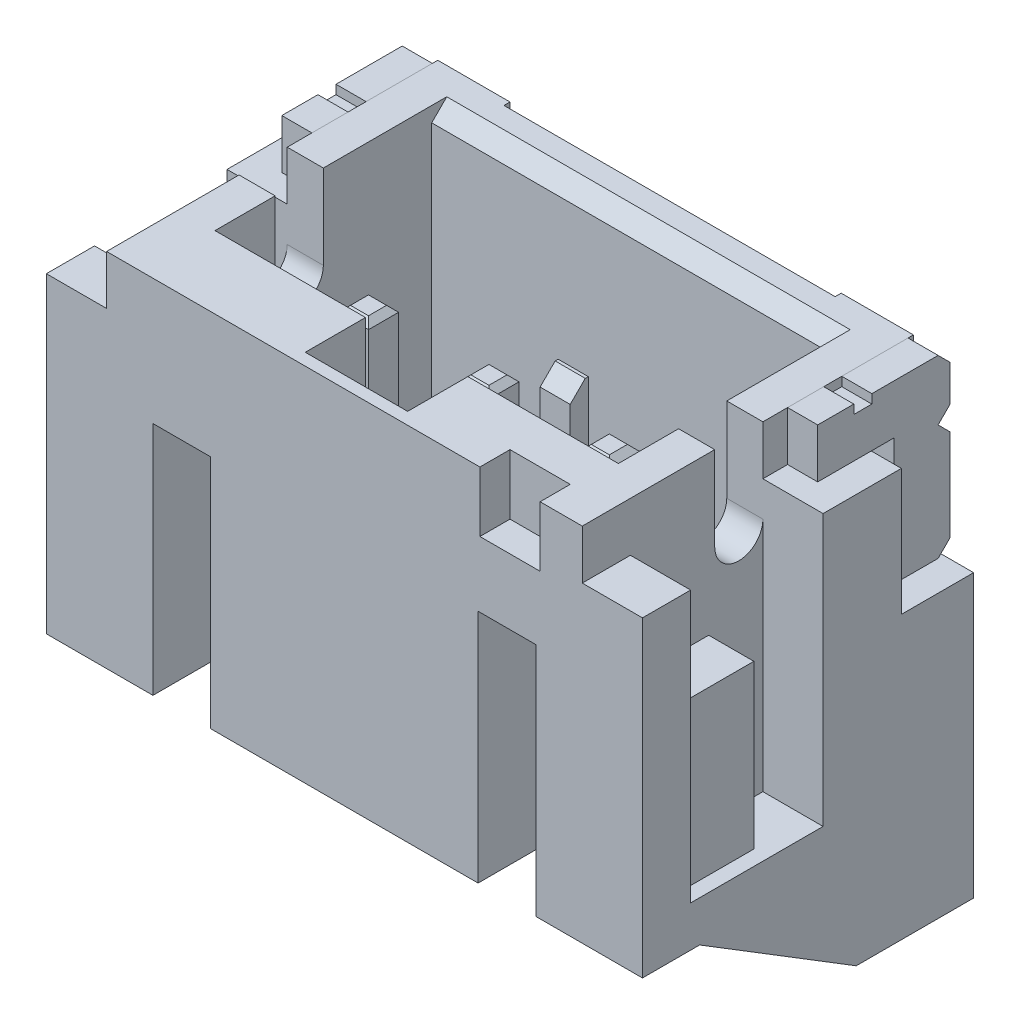
from build123d import *
from OCP.BRepFilletAPI import BRepFilletAPI_MakeChamfer

# Parameters (mm, degrees)
BODY1_W                               = 7.9
BODY1_H                               = 5.5
EXTRUDE_1_DEPTH                       = 6
SKETCH_2_W                            = 6.7
SKETCH_2_H                            = 3.6
CUT_EXTRUDE_1_DEPTH                   = 4.2
SKETCH_5_W                            = 0.7
SKETCH_5_H                            = 4.15
CUT_EXTRUDE_4_DEPTH                   = 0.4
SKETCH_8_W                            = 1.7
SKETCH_8_H                            = 4.2
CUT_EXTRUDE_6_DEPTH                   = 0.75
CUT_EXTRUDE_7_REACH                   = 13.343
SKETCH_10_W                           = 0.5
SKETCH_10_H                           = 1.6
EXTRUDE_2_DEPTH                       = 0.3
CHAMFER_2_SIZE                        = 0.25
PATTERN_LINEAR_3_COUNT                = 2
PATTERN_LINEAR_3_PITCH                = 2
CHAMFER_2_OF_PATTERN_LINEAR_3_SIZE    = 0.25
SKETCH_18_W                           = 5.5
SKETCH_18_H                           = 6
CUT_EXTRUDE_8_DEPTH                   = 0.1
EXTRUDE_6_DEPTH                       = 1
SKETCH_20_W                           = 1.3
SKETCH_20_H                           = 2.7
EXTRUDE_7_DEPTH                       = 0.75
EXTRUDE_8_DEPTH                       = 0.5
CHAMFER_9_SIZE                        = 0.25
SWEEP_START                           = 1.7
SWEEP_1_DEPTH                         = 0.5
CHAMFER_8_SIZE                        = 0.1
SKETCH_22_W                           = 1.6
SKETCH_22_H                           = 3.25
EXTRUDE_9_DEPTH                       = 0.2
CHAMFER_10_SIZE                       = 0.072794047
CHAMFER_10_SIZE_2                     = 0.2
CHAMFER_11_SIZE2                      = 0.2
CHAMFER_11_SIZE                       = 0.549495484
PATTERN_LINEAR_5_COUNT                = 3
PATTERN_LINEAR_5_PITCH                = 2
CHAMFER_8_OF_PATTERN_LINEAR_5_SIZE    = 0.1
CHAMFER_10_OF_PATTERN_LINEAR_5_SIZE   = 0.072794047
CHAMFER_10_OF_PATTERN_LINEAR_5_SIZE_2 = 0.2
CHAMFER_11_OF_PATTERN_LINEAR_5_SIZE   = 0.549495484
CHAMFER_11_OF_PATTERN_LINEAR_5_SIZE_2 = 0.2
SKETCH_4_W                            = 0.96
SKETCH_4_H                            = 3.91
CUT_EXTRUDE_3_DEPTH                   = 1.2
SKETCH_23_W                           = 1
SKETCH_23_H                           = 0.5
CUT_EXTRUDE_9_DEPTH                   = 1
SKETCH_24_R                           = 0.05
CUT_EXTRUDE_10_DEPTH                  = 0.1


# Read off the part's stored shape, not the designer's step: По траектории1
with BuildPart() as part:
    # Body1 → Бобышка-Вытянуть1 (new body)
    with BuildSketch(Plane(origin=(0, 0, 0), x_dir=(1, 0, 0), z_dir=(0, 1, 0))):
        with Locations((3.95, -2.75)):
            Rectangle(BODY1_W, BODY1_H)
    extrude(amount=EXTRUDE_1_DEPTH)

    # Эскиз2 → Вырез-Вытянуть1 (cut)
    with BuildSketch(Plane(origin=(0, 6, 0), x_dir=(1, 0, 0), z_dir=(0, 1, 0))):
        with Locations((3.95, -2.5)):
            Rectangle(SKETCH_2_W, SKETCH_2_H)
    extrude(amount=-CUT_EXTRUDE_1_DEPTH, mode=Mode.SUBTRACT)

    # Эскиз5 → Вырез-Вытянуть4 (cut)
    with BuildSketch(Plane(origin=(0, 0, 4.8), x_dir=(1, 0, 0), z_dir=(0, 1, 0))):
        with Locations((1.95, 2.725)):
            Rectangle(SKETCH_5_W, SKETCH_5_H)
    cut_extrude_4 = extrude(amount=CUT_EXTRUDE_4_DEPTH, mode=Mode.SUBTRACT)

    # Эскиз8 → Вырез-Вытянуть6 (cut)
    with BuildSketch(Plane.XY.offset(4.3)):
        with Locations((3.95, 3.9)):
            Rectangle(SKETCH_8_W, SKETCH_8_H)
    extrude(amount=CUT_EXTRUDE_6_DEPTH, mode=Mode.SUBTRACT)

    # Эскиз9 → Вырез-Вытянуть7 (cut, up to next)
    with BuildSketch(Plane.ZY, mode=Mode.PRIVATE) as cut_extrude_7_sk1:
        with BuildLine():
            Line((2.5, 6), (3.3, 6))
            Line((3.3, 6), (3.3, 4.6))
            ThreePointArc((3.3, 4.6), (2.9, 4.2), (2.5, 4.6))
            Line((2.5, 4.6), (2.5, 6))
        make_face()
    cut_extrude_7_tool1 = extrude(cut_extrude_7_sk1.sketch, amount=-CUT_EXTRUDE_7_REACH, mode=Mode.PRIVATE) & part.part
    cut_extrude_7 = cut_extrude_7_tool1.solids().sort_by_distance((0, 5.140595, 2.9))[0]
    add(cut_extrude_7, mode=Mode.SUBTRACT)

    # Зеркальное отражение1: Вырез-Вытянуть7 across plane
    add(cut_extrude_7.mirror(Plane(origin=(3.95, 0, 0), x_dir=(0, 0, 1), z_dir=(1, 0, 0))), mode=Mode.SUBTRACT)

    # Эскиз10 → Бобышка-Вытянуть2 (add)
    with BuildSketch(Plane.XY.offset(0.7)):
        with Locations((2.95, 2.6)):
            Rectangle(SKETCH_10_W, SKETCH_10_H)
    extrude_2 = extrude(amount=EXTRUDE_2_DEPTH)

    # Фаска2
    chamfer_2_edges = [part.edges().sort_by_distance(p)[0] for p in [
        (2.95, 3.4, 1),
    ]]
    chamfer(chamfer_2_edges, length=CHAMFER_2_SIZE)

    # Линейный массив3: Бобышка-Вытянуть2 ×2
    with Locations(*[(i * PATTERN_LINEAR_3_PITCH, 0, 0) for i in range(1, PATTERN_LINEAR_3_COUNT)]):
        add(extrude_2)

    # Фаска2 of Линейный массив3
    chamfer_2_of_pattern_linear_3_edges = [part.edges().sort_by_distance(p)[0] for p in [
        (4.95, 3.4, 1),
    ]]
    chamfer(chamfer_2_of_pattern_linear_3_edges, length=CHAMFER_2_OF_PATTERN_LINEAR_3_SIZE)

    # Эскиз18 → Вырез-Вытянуть8 (cut)
    with BuildSketch(Plane(origin=(0, 0, 0), x_dir=(-1, 0, 0), z_dir=(0, 0, -1))):
        with Locations((-3.95, 3)):
            Rectangle(SKETCH_18_W, SKETCH_18_H)
    extrude(amount=-CUT_EXTRUDE_8_DEPTH, mode=Mode.SUBTRACT)

    # Эскиз19 → Бобышка-Вытянуть6 (add)
    with BuildSketch(Plane.ZY):
        Polygon((5.5, 5.18), (4.7, 5.18), (4.7, 0.68), (2.5, 0.68), (2.5, 5.18), (1.2, 5.18), (1.2, 3.08), (0, 3.08), (0, 0), (0, -1.6), (1.95, -1.6), (4.55, 0), (5.5, 0), align=None)
    extrude_6 = extrude(amount=EXTRUDE_6_DEPTH)

    # Эскиз20 → Бобышка-Вытянуть7 (add)
    with BuildSketch(Plane.ZY):
        with Locations((4.05, 2.03)):
            Rectangle(SKETCH_20_W, SKETCH_20_H)
    extrude_7 = extrude(amount=EXTRUDE_7_DEPTH)

    # Зеркальное отражение4: Бобышка-Вытянуть6, Бобышка-Вытянуть7 across plane
    add(extrude_6.mirror(Plane(origin=(3.95, 0, 0), x_dir=(0, 0, 1), z_dir=(1, 0, 0))))
    add(extrude_7.mirror(Plane(origin=(3.95, 0, 0), x_dir=(0, 0, 1), z_dir=(1, 0, 0))))

    # Фаска9
    chamfer_9_edges = [part.edges().sort_by_distance(p)[0] for p in [
        (3.95, 6, 0.7),
        (3.95, 6, 5.05),
    ]]
    chamfer(chamfer_9_edges, length=CHAMFER_9_SIZE)

    # По траектории1 outline → По траектории1 (add)
    with BuildSketch(Plane.YZ.offset(SWEEP_START)):
        with BuildLine():
            add(Edge.make_bspline(
                [(1.8, 3.35), (2.1, 3.35), (2.4, 3.35), (3.466666667, 3.35), (4.233333333, 3.35), (5, 3.35)],
                knots=[0.550626024, 0.550626024, 0.550626024, 0.550626024, 0.677012455, 0.677012455, 1, 1, 1, 1], degree=3))
            Line((1.8, 3.35), (1.8, 2.85))
            add(Edge.make_bspline(
                [(1.8, 2.85), (2.1, 2.85), (2.4, 2.85), (3.466666667, 2.85), (4.233333333, 2.85), (5, 2.85)],
                knots=[0.550626024, 0.550626024, 0.550626024, 0.550626024, 0.677012455, 0.677012455, 1, 1, 1, 1], degree=3))
            Line((5, 2.85), (5, 3.35))
        make_face()
        with BuildLine():
            Line((-1.6662e-05, 0.942155021), (0, 2.45))
            add(Edge.make_bspline(
                [(0, 2.45), (0, 2.553716576), (0.042196888, 2.657882313), (0.154637487, 2.770322912), (0.199605417, 2.800099176), (0.296209882, 2.839814108), (0.331279974, 2.849979865), (0.4, 2.85)],
                knots=[0.210644051, 0.210644051, 0.210644051, 0.210644051, 0.28233448, 0.28233448, 0.318179695, 0.318179695, 0.354024909, 0.354024909, 0.354024909, 0.354024909], degree=3))
            Line((0.4, 2.85), (0.4, 3.35))
            add(Edge.make_bspline(
                [(-0.5, 2.45), (-0.5, 2.683362296), (-0.405057001, 2.917735205), (-0.152065654, 3.170726552), (-0.050887811, 3.237723146), (0.166472235, 3.327081743), (0.298557942, 3.349954697), (0.4, 3.35)],
                knots=[0.210644051, 0.210644051, 0.210644051, 0.210644051, 0.28233448, 0.28233448, 0.318179695, 0.318179695, 0.354024909, 0.354024909, 0.354024909, 0.354024909], degree=3))
            Line((-0.5, 2.45), (-0.500062578, 0.957586603))
            ThreePointArc((-0.500062578, 0.957586603), (-0.606740821, 0.699860892), (-0.84481038, 0.554514153))
            Line((-0.84481038, 0.554514153), (-2.621788936, 0.399048675))
            Line((-2.621788936, 0.399048675), (-2.578211064, -0.099048675))
            Line((-2.578211064, -0.099048675), (-0.77045154, 0.05910979))
            add(Edge.make_bspline(
                [(-0.77045154, 0.05910979), (-0.765813702, 0.060071241), (-0.761062531, 0.061056387), (-0.666053166, 0.08076061), (-0.554662574, 0.121818295), (-0.377229261, 0.226512766), (-0.297597323, 0.293038319), (-0.096380688, 0.525428514), (-0.013265113, 0.723592781), (-0.000458027, 0.934873745), (-0.000310905, 0.937300837), (-0.000163784, 0.939727929), (-1.6662e-05, 0.942155021)],
                knots=[-0.013536462, -0.013536462, -0.013536462, -0.013536462, 0, 0, 0.25, 0.25, 0.5, 0.5, 1, 1, 1, 1.005743755, 1.005743755, 1.005743755, 1.005743755], degree=3))
        make_face()
    sweep_1 = extrude(amount=SWEEP_1_DEPTH)

    # Фаска8
    chamfer_8_edges = [part.edges().sort_by_distance(p)[0] for p in [
        (1.95, 5, 2.85),
        (2.2, 5, 3.1),
        (1.95, 5, 3.35),
        (1.7, 5, 3.1),
        (1.95, -2.621788936, 0.399048675),
        (2.2, -2.6, 0.15),
        (1.95, -2.578211064, -0.099048675),
        (1.7, -2.6, 0.15),
    ]]
    chamfer(chamfer_8_edges, length=CHAMFER_8_SIZE)

    # Эскиз22 → Бобышка-Вытянуть9 (add)
    with BuildSketch(Plane(origin=(0, 1.8, 0), x_dir=(1, 0, 0), z_dir=(0, 1, 0))):
        with Locations((1.95, -3.425)):
            Rectangle(SKETCH_22_W, SKETCH_22_H)
    extrude_9 = extrude(amount=EXTRUDE_9_DEPTH)

    # Фаска10
    chamfer_10_edges_1 = [part.edges().sort_by_distance(p)[0] for p in [
        (1.15, 2, 3.05),
    ]]
    chamfer_10_side_1 = [part.faces().sort_by_distance(p)[0] for p in [
        (1.151455881, 2, 3.05),
    ]]
    chamfer_10_edges_2 = [part.edges().sort_by_distance(p)[0] for p in [
        (2.75, 2, 3.05),
    ]]
    chamfer_10_side_2 = [part.faces().sort_by_distance(p)[0] for p in [
        (2.748544119, 2, 3.05),
    ]]
    chamfer_10 = BRepFilletAPI_MakeChamfer(part.part.solid().wrapped)
    for e in chamfer_10_edges_1:
        chamfer_10.Add(CHAMFER_10_SIZE - 0.0001, CHAMFER_10_SIZE_2 - 0.0001, e.wrapped, chamfer_10_side_1[0].wrapped)
    for e in chamfer_10_edges_2:
        chamfer_10.Add(CHAMFER_10_SIZE - 0.0001, CHAMFER_10_SIZE_2 - 0.0001, e.wrapped, chamfer_10_side_2[0].wrapped)
    add(Compound.cast(chamfer_10.Shape()), mode=Mode.REPLACE)  # a hair under: the kernel refuses the full size

    # Фаска11
    chamfer_11_edges = [part.edges().sort_by_distance(p)[0] for p in [
        (1.95, 2, 1.8),
    ]]
    chamfer_11_side = [part.faces().sort_by_distance(p)[0] for p in [
        (1.95, 2, 1.804),
    ]]
    chamfer(chamfer_11_edges, length=CHAMFER_11_SIZE - 0.0001, length2=CHAMFER_11_SIZE2 - 0.0001, reference=chamfer_11_side[0])  # a hair under: the kernel refuses the full size

    # Линейный массив5: Вырез-Вытянуть4, По траектории1, Бобышка-Вытянуть9 ×3
    with Locations(*[(i * PATTERN_LINEAR_5_PITCH, 0, 0) for i in range(1, PATTERN_LINEAR_5_COUNT)]):
        add(cut_extrude_4, mode=Mode.SUBTRACT)
        add(sweep_1)
        add(extrude_9)

    # Фаска8 of Линейный массив5
    chamfer_8_of_pattern_linear_5_edges = [part.edges().sort_by_distance(p)[0] for p in [
        (3.95, 5, 2.85),
        (4.2, 5, 3.1),
        (3.95, 5, 3.35),
        (3.7, 5, 3.1),
        (3.95, -2.621788936, 0.399048675),
        (4.2, -2.6, 0.15),
        (3.95, -2.578211064, -0.099048675),
        (3.7, -2.6, 0.15),
        (5.95, 5, 2.85),
        (6.2, 5, 3.1),
        (5.95, 5, 3.35),
        (5.7, 5, 3.1),
        (5.95, -2.621788936, 0.399048675),
        (6.2, -2.6, 0.15),
        (5.95, -2.578211064, -0.099048675),
        (5.7, -2.6, 0.15),
    ]]
    chamfer(chamfer_8_of_pattern_linear_5_edges, length=CHAMFER_8_OF_PATTERN_LINEAR_5_SIZE)

    # Фаска10 of Линейный массив5
    chamfer_10_of_pattern_linear_5_edges_1 = [part.edges().sort_by_distance(p)[0] for p in [
        (3.15, 2, 3.425),
    ]]
    chamfer_10_of_pattern_linear_5_side_1 = [part.faces().sort_by_distance(p)[0] for p in [
        (3.151455881, 2, 3.425),
    ]]
    chamfer_10_of_pattern_linear_5_edges_2 = [part.edges().sort_by_distance(p)[0] for p in [
        (4.75, 2, 3.425),
    ]]
    chamfer_10_of_pattern_linear_5_side_2 = [part.faces().sort_by_distance(p)[0] for p in [
        (4.748544119, 2, 3.425),
    ]]
    chamfer_10_of_pattern_linear_5_edges_3 = [part.edges().sort_by_distance(p)[0] for p in [
        (5.15, 2, 3.05),
    ]]
    chamfer_10_of_pattern_linear_5_side_3 = [part.faces().sort_by_distance(p)[0] for p in [
        (5.15, 1.998544119, 3.05),
    ]]
    chamfer_10_of_pattern_linear_5_edges_4 = [part.edges().sort_by_distance(p)[0] for p in [
        (6.75, 2, 3.05),
    ]]
    chamfer_10_of_pattern_linear_5_side_4 = [part.faces().sort_by_distance(p)[0] for p in [
        (6.75, 1.998544119, 3.05),
    ]]
    chamfer_10_of_pattern_linear_5 = BRepFilletAPI_MakeChamfer(part.part.solid().wrapped)
    for e in chamfer_10_of_pattern_linear_5_edges_1:
        chamfer_10_of_pattern_linear_5.Add(CHAMFER_10_OF_PATTERN_LINEAR_5_SIZE - 0.0001, CHAMFER_10_OF_PATTERN_LINEAR_5_SIZE_2 - 0.0001, e.wrapped, chamfer_10_of_pattern_linear_5_side_1[0].wrapped)
    for e in chamfer_10_of_pattern_linear_5_edges_2:
        chamfer_10_of_pattern_linear_5.Add(CHAMFER_10_OF_PATTERN_LINEAR_5_SIZE - 0.0001, CHAMFER_10_OF_PATTERN_LINEAR_5_SIZE_2 - 0.0001, e.wrapped, chamfer_10_of_pattern_linear_5_side_2[0].wrapped)
    for e in chamfer_10_of_pattern_linear_5_edges_3:
        chamfer_10_of_pattern_linear_5.Add(CHAMFER_10_OF_PATTERN_LINEAR_5_SIZE_2 - 0.0001, CHAMFER_10_OF_PATTERN_LINEAR_5_SIZE - 0.0001, e.wrapped, chamfer_10_of_pattern_linear_5_side_3[0].wrapped)
    for e in chamfer_10_of_pattern_linear_5_edges_4:
        chamfer_10_of_pattern_linear_5.Add(CHAMFER_10_OF_PATTERN_LINEAR_5_SIZE_2 - 0.0001, CHAMFER_10_OF_PATTERN_LINEAR_5_SIZE - 0.0001, e.wrapped, chamfer_10_of_pattern_linear_5_side_4[0].wrapped)
    add(Compound.cast(chamfer_10_of_pattern_linear_5.Shape()), mode=Mode.REPLACE)  # a hair under: the kernel refuses the full size

    # Фаска11 of Линейный массив5
    chamfer_11_of_pattern_linear_5_edges_1 = [part.edges().sort_by_distance(p)[0] for p in [
        (3.95, 2, 1.8),
    ]]
    chamfer_11_of_pattern_linear_5_side_1 = [part.faces().sort_by_distance(p)[0] for p in [
        (3.95, 2, 1.804),
    ]]
    chamfer_11_of_pattern_linear_5_edges_2 = [part.edges().sort_by_distance(p)[0] for p in [
        (5.95, 2, 1.8),
    ]]
    chamfer_11_of_pattern_linear_5_side_2 = [part.faces().sort_by_distance(p)[0] for p in [
        (5.95, 1.996, 1.8),
    ]]
    chamfer_11_of_pattern_linear_5 = BRepFilletAPI_MakeChamfer(part.part.solid().wrapped)
    for e in chamfer_11_of_pattern_linear_5_edges_1:
        chamfer_11_of_pattern_linear_5.Add(CHAMFER_11_OF_PATTERN_LINEAR_5_SIZE - 0.0001, CHAMFER_11_OF_PATTERN_LINEAR_5_SIZE_2 - 0.0001, e.wrapped, chamfer_11_of_pattern_linear_5_side_1[0].wrapped)
    for e in chamfer_11_of_pattern_linear_5_edges_2:
        chamfer_11_of_pattern_linear_5.Add(CHAMFER_11_OF_PATTERN_LINEAR_5_SIZE_2 - 0.0001, CHAMFER_11_OF_PATTERN_LINEAR_5_SIZE - 0.0001, e.wrapped, chamfer_11_of_pattern_linear_5_side_2[0].wrapped)
    add(Compound.cast(chamfer_11_of_pattern_linear_5.Shape()), mode=Mode.REPLACE)  # a hair under: the kernel refuses the full size

    # Эскиз4 → Вырез-Вытянуть3 (cut)
    with BuildSketch(Plane.XY.offset(5.5)):
        with Locations((1.25, 1.955)):
            Rectangle(SKETCH_4_W, SKETCH_4_H)
        with Locations((6.65, 1.955)):
            Rectangle(SKETCH_4_W, SKETCH_4_H)
    extrude(amount=-CUT_EXTRUDE_3_DEPTH, mode=Mode.SUBTRACT)

    # Эскиз23 → Вырез-Вытянуть9 (cut)
    with BuildSketch(Plane(origin=(0, 6, 0), x_dir=(1, 0, 0), z_dir=(0, 1, 0))):
        with Locations((6.7, -5.25)):
            Rectangle(SKETCH_23_W, SKETCH_23_H)
    extrude(amount=-CUT_EXTRUDE_9_DEPTH, mode=Mode.SUBTRACT)


with BuildPart() as body_2:
    # Эскиз21 → Бобышка-Вытянуть8 (new body)
    with BuildSketch(Plane.ZY):
        Polygon((2.09, 5.18), (2.09, 6), (1.49, 6), (1.49, 5.85), (1.19, 5.85), (1.19, 6), (0.09, 6), (-0.11, 5.8), (-0.11, 5.2), (0.09, 5), (-0.11, 4.8), (-0.11, 3.28), (0.09, 3.08), (0.823402773, 3.08), (0.823402773, 5.18), align=None)
    extrude(amount=EXTRUDE_8_DEPTH)


with BuildPart() as body_3:
    # Зеркальное отражение6: mirrored copy
    add(body_2.part.mirror(Plane(origin=(3.95, 0, 0), x_dir=(0, 0, 1), z_dir=(1, 0, 0))))


with BuildPart() as body_2_1:
    add(body_2.part)

    # Эскиз24 → Вырез-Вытянуть10 (cut)
    with BuildSketch(Plane(origin=(0, 0, -0.11), x_dir=(-1, 0, 0), z_dir=(0, 0, -1))):
        with Locations(Location((0.25, 4.54, 0), (0, 0, 90))):
            Circle(SKETCH_24_R)
    extrude(amount=-CUT_EXTRUDE_10_DEPTH, mode=Mode.SUBTRACT)


solid = Compound([part.part, body_3.part, body_2_1.part])
